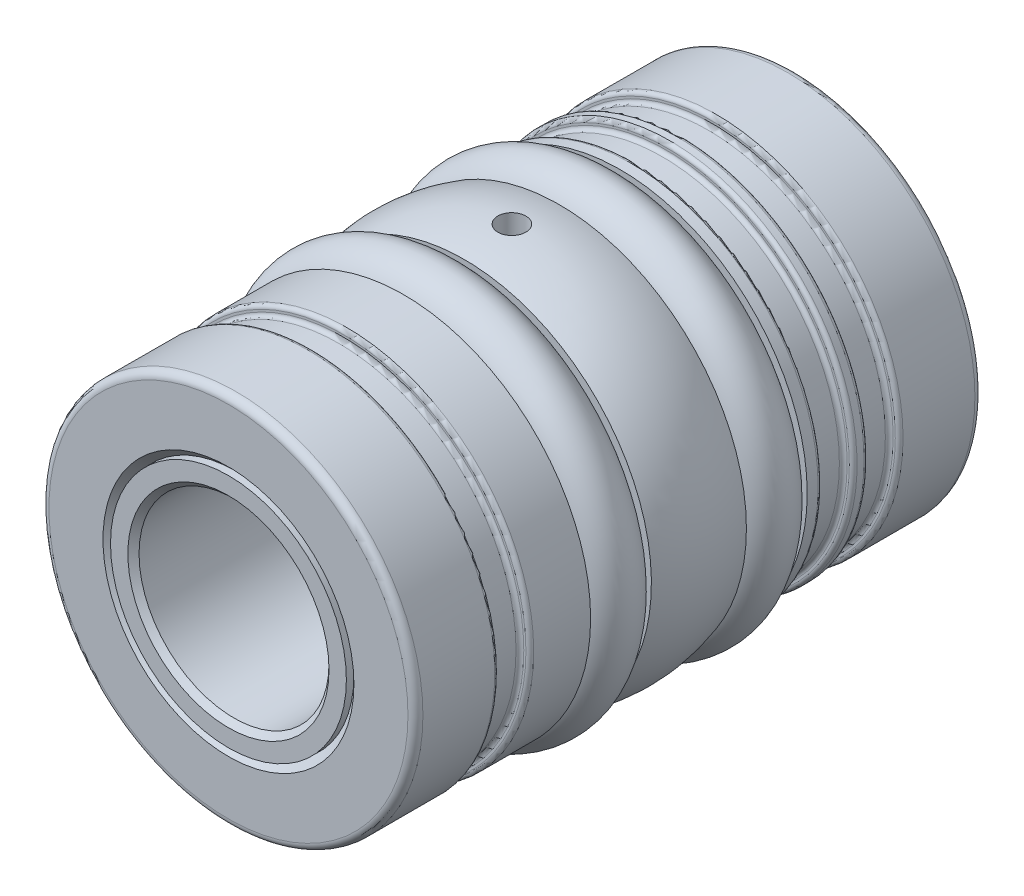
from build123d import *

# Parameters (mm, degrees)
BORE_DEPTH                      = 13.95674403
BORE_DEPTH_BACK                 = 13.95674403
SKETCH16_R                      = 3.175
CUT_REVOLVE_THIN1_START         = -9.4742
CUT_REVOLVE_THIN1_OUTLINE_R     = 3.9436675
CUT_REVOLVE_THIN1_OUTLINE_R_2   = 3.175
CUT_REVOLVE_THIN1_DEPTH         = 18.9484
CUT_REVOLVE_THIN1_2_OUTLINE_R   = 3.9416675
CUT_REVOLVE_THIN1_2_OUTLINE_R_2 = 3.175
CUT_REVOLVE_THIN1_2_DEPTH       = 18.9484
SKETCH11_W                      = 2.032
SKETCH11_H                      = 1.18237
SKETCH17_W                      = 1.0414
SKETCH17_H                      = 0.33147
SKETCH14_R                      = 1.016
SKETCH12_R                      = 0.46872525
CUT_EXTRUDE3_DEPTH              = 14.373779135
FILLET1_R                       = 0.2499868
FILLET2_R                       = 0.130175
CHAMFER1_SIZE                   = 0.2499868
CHAMFER2_SIZE                   = 0.18669


with BuildPart() as part:
    # Sketch15 → Bearing (revolve)
    with BuildSketch(Plane(origin=(0, 0, 0), x_dir=(0, 0, -1), z_dir=(1, 0, 0)), mode=Mode.PRIVATE) as bearing_sk:
        Polygon((-9.4742, 0), (9.4742, 0), (9.4742, -6.24967), (6.6929, -6.24967), (6.6929, -5.9182), (5.6515, -5.9182), (5.6515, -6.24967), (-5.6515, -6.24967), (-5.6515, -5.9182), (-6.6929, -5.9182), (-6.6929, -6.24967), (-9.4742, -6.24967), align=None)
    revolve(bearing_sk.sketch.rotate(Axis((0, 0, 9.4742), (0, 0, -1)), 270), axis=Axis((0, 0, 9.4742), (0, 0, -1)))

    # Sketch16 → Bore (cut, two sides: drawn at the far end of the back side and taken through both)
    with BuildSketch(Plane.XY.offset(-BORE_DEPTH_BACK)):
        Circle(SKETCH16_R)
    extrude(amount=BORE_DEPTH + BORE_DEPTH_BACK, mode=Mode.SUBTRACT)

    # Cut-Revolve-Thin1: read off the stored shape, not the designer's step
    # Cut-Revolve-Thin1 outline → Cut-Revolve-Thin1 (cut)
    with BuildSketch(Plane.XY.offset(CUT_REVOLVE_THIN1_START)):
        Circle(CUT_REVOLVE_THIN1_OUTLINE_R)
        Circle(CUT_REVOLVE_THIN1_OUTLINE_R_2, mode=Mode.SUBTRACT)
    extrude(amount=CUT_REVOLVE_THIN1_DEPTH, mode=Mode.SUBTRACT)

    # Sketch11 → Cut-Revolve1 (revolve, cut)
    with BuildSketch(Plane(origin=(0, 0, 0), x_dir=(0, 0, -1), z_dir=(1, 0, 0)), mode=Mode.PRIVATE) as cut_revolve1_sk:
        with Locations((-2.6035, -5.658485)):
            Rectangle(SKETCH11_W, SKETCH11_H)
        with Locations((2.6035, -5.658485)):
            Rectangle(SKETCH11_W, SKETCH11_H)
    revolve(cut_revolve1_sk.sketch.rotate(Axis((0, 0, 9.4742), (0, 0, -1)), 270), axis=Axis((0, 0, 9.4742), (0, 0, -1)), mode=Mode.SUBTRACT)

    # Sketch17 → Cut-Revolve2 (revolve, cut)
    with BuildSketch(Plane(origin=(0, 0, 0), x_dir=(0, 0, -1), z_dir=(1, 0, 0)), mode=Mode.PRIVATE) as cut_revolve2_sk:
        with Locations((4.6355, -6.083935)):
            Rectangle(SKETCH17_W, SKETCH17_H)
    revolve(cut_revolve2_sk.sketch.rotate(Axis((0, 0, 9.4742), (0, 0, -1)), 270), axis=Axis((0, 0, 9.4742), (0, 0, -1)), mode=Mode.SUBTRACT)

    # Sketch13 → Revolve5 (revolve)
    with BuildSketch(Plane(origin=(0, 0, 0), x_dir=(0, 0, -1), z_dir=(1, 0, 0)), mode=Mode.PRIVATE) as revolve5_sk:
        with BuildLine():
            Line((-1.5875, 6.24967), (1.5875, 6.24967))
            ThreePointArc((1.5875, 6.24967), (0, 6.49967), (-1.5875, 6.24967))
        make_face()
    revolve(revolve5_sk.sketch.rotate(Axis((0, 0, 9.4742), (0, 0, -1)), 180), axis=Axis((0, 0, 9.4742), (0, 0, -1)))

    # Sketch12 → Cut-Extrude3 (cut, through all)
    with BuildSketch(Plane(origin=(0, 0, 0), x_dir=(1, 0, 0), z_dir=(0, 1, 0))):
        with Locations(Location((0, 0, 0), (0, 0, 90))):
            Circle(SKETCH12_R)
    extrude(amount=CUT_EXTRUDE3_DEPTH, mode=Mode.SUBTRACT)

    # Fillet1
    fillet1_edges = [part.edges().sort_by_distance(p)[0] for p in [
        (-6.24967, 0, -9.4742),
        (-6.24967, 0, 9.4742),
    ]]
    fillet(fillet1_edges, radius=FILLET1_R)

    # Fillet2
    fillet2_edges = [part.edges().sort_by_distance(p)[0] for p in [
        (-6.24967, 0, 6.6929),
        (-5.9182, 0, 6.6929),
        (-5.9182, 0, 5.6515),
        (-6.24967, 0, 5.6515),
        (-6.24967, 0, -5.6515),
        (-5.9182, 0, -5.6515),
        (-5.9182, 0, -6.6929),
        (-6.24967, 0, -6.6929),
        (-5.9182, 0, -5.1562),
        (-6.24967, 0, -5.1562),
        (-6.24967, 0, -4.1148),
        (-5.9182, 0, -4.1148),
    ]]
    fillet(fillet2_edges, radius=FILLET2_R)

    # Chamfer1
    chamfer1_edges = [part.edges().sort_by_distance(p)[0] for p in [
        (-3.9436675, 0, -9.4742),
        (-3.9436675, 0, 9.4742),
    ]]
    chamfer(chamfer1_edges, length=CHAMFER1_SIZE)


with BuildPart() as body_2:
    # Cut-Revolve-Thin1 2 outline → Cut-Revolve-Thin1 2 (new body)
    with BuildSketch(Plane.XY.offset(CUT_REVOLVE_THIN1_START)):
        Circle(CUT_REVOLVE_THIN1_2_OUTLINE_R)
        Circle(CUT_REVOLVE_THIN1_2_OUTLINE_R_2, mode=Mode.SUBTRACT)
    extrude(amount=CUT_REVOLVE_THIN1_2_DEPTH)

    # Chamfer2
    chamfer2_edges = [body_2.edges().sort_by_distance(p)[0] for p in [
        (-3.175, 0, -9.4742),
        (-3.175, 0, 9.4742),
    ]]
    chamfer(chamfer2_edges, length=CHAMFER2_SIZE)


with BuildPart() as body_3:
    # Sketch14 → Revolve8 (revolve)
    with BuildSketch(Plane(origin=(0, 0, 0), x_dir=(0, 0, -1), z_dir=(1, 0, 0)), mode=Mode.PRIVATE) as revolve8_sk:
        with Locations((-2.6035, 5.658485)):
            Circle(SKETCH14_R)
        with Locations((2.6035, 5.658485)):
            Circle(SKETCH14_R)
    revolve(revolve8_sk.sketch.rotate(Axis((0, 0, 9.4742), (0, 0, -1)), 180), axis=Axis((0, 0, 9.4742), (0, 0, -1)))


solid = Compound([part.part, body_2.part, body_3.part])
